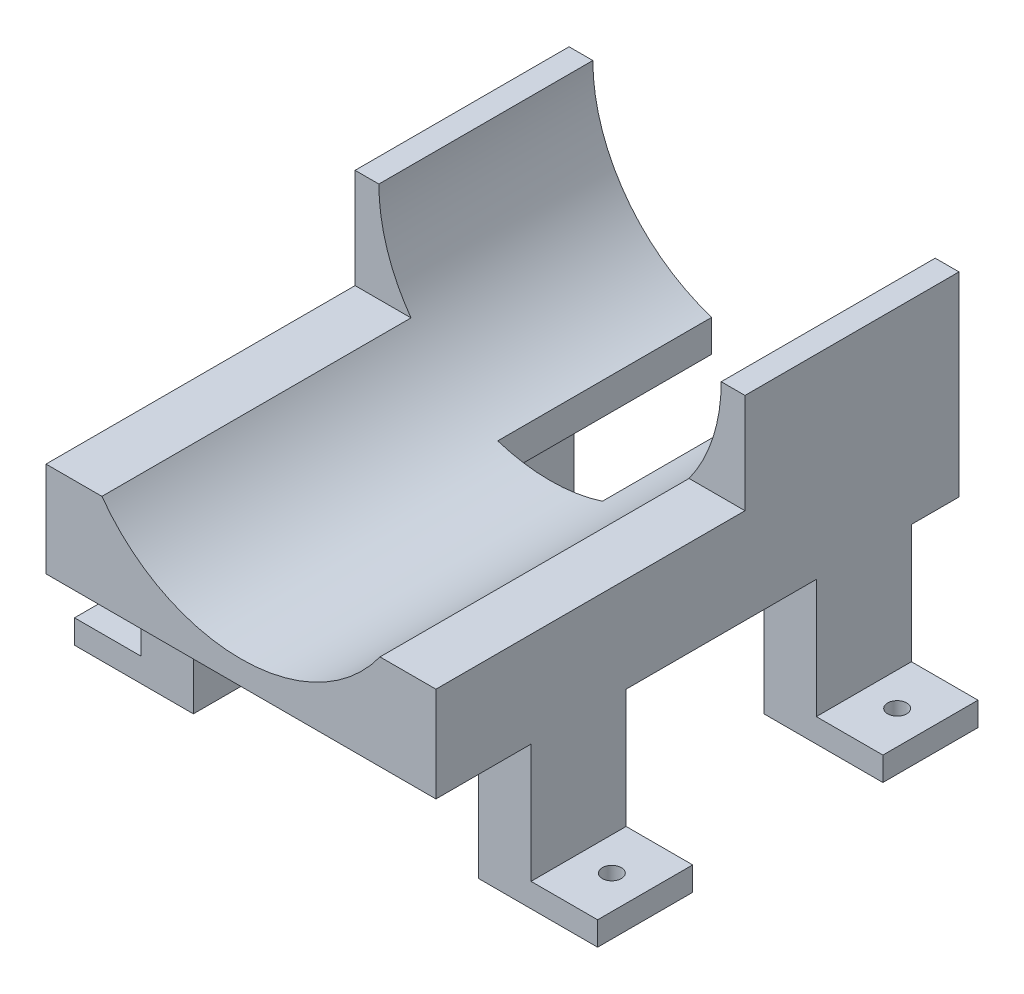
from build123d import *

# Parameters (mm, degrees)
SKETCH_1_R               = 36
EXTRUDE_1_DEPTH          = 90
SKETCH_2_W               = 22
SKETCH_2_H               = 6.721726998
CUT_EXTRUDE_1_DEPTH      = 45
CUT_EXTRUDE_2_DEPTH      = 108.060730429
CUT_EXTRUDE_2_DEPTH_BACK = 108.060730429
EXTRUDE_3_DEPTH          = 20
SKETCH_5_R               = 2
CUT_EXTRUDE_3_DEPTH      = 125.422666745
PATTERN_LINEAR_1_COUNT   = 2
PATTERN_LINEAR_1_PITCH   = 60
EXTRUDE_4_DEPTH          = 20


with BuildPart() as part:
    # 草圖1 → 填料-伸長1 (new body)
    with BuildSketch(Plane.XY):
        with BuildLine():
            Line((-41, 0), (-41, -41))
            Line((-41, -41), (41, -41))
            Line((41, -41), (41, 0))
            ThreePointArc((41, 0), (0, 41), (-41, 0))
        make_face()
        Circle(SKETCH_1_R, mode=Mode.SUBTRACT)
    extrude(amount=EXTRUDE_1_DEPTH)

    # 草圖2 → 除料-伸長1 (cut)
    with BuildSketch(Plane.XY):
        with Locations((0, -37.639136501)):
            Rectangle(SKETCH_2_W, SKETCH_2_H)
    extrude(amount=CUT_EXTRUDE_1_DEPTH, mode=Mode.SUBTRACT)

    # 草圖3 → 除料-伸長2 (cut, two sides: drawn at the far end of the back side and taken through both)
    with BuildSketch(Plane(origin=(0, 0, 0), x_dir=(0, 0, -1), z_dir=(1, 0, 0)).offset(-CUT_EXTRUDE_2_DEPTH_BACK)):
        Polygon((0, 41), (-90, 41), (-90, -21), (-45, -21), (-45, 0), (0, 0), align=None)
    extrude(amount=CUT_EXTRUDE_2_DEPTH + CUT_EXTRUDE_2_DEPTH_BACK, mode=Mode.SUBTRACT)

    # 草圖4 → 填料-伸長3 (add)
    with BuildSketch(Plane.XY.offset(90)):
        with BuildLine():
            Line((-30, -71), (-30, -27.946386022))
            ThreePointArc((-30, -27.946386022), (-32.791276328, -24.611637258), (-35.213640705, -21))
            Line((-35.213640705, -21), (-41, -21))
            Line((-41, -21), (-41, -66))
            Line((-41, -66), (-55, -66))
            Line((-55, -66), (-55, -71))
            Line((-55, -71), (-30, -71))
        make_face()
        with BuildLine():
            Line((30, -71), (30, -27.946386022))
            ThreePointArc((30, -27.946386022), (32.791276328, -24.611637258), (35.213640705, -21))
            Line((35.213640705, -21), (41, -21))
            Line((41, -21), (41, -66))
            Line((41, -66), (55, -66))
            Line((55, -66), (55, -71))
            Line((55, -71), (30, -71))
        make_face()
    extrude_3 = extrude(amount=-EXTRUDE_3_DEPTH)

    # 草圖5 → 除料-伸長3 (cut, through all)
    with BuildSketch(Plane(origin=(0, -66, 0), x_dir=(1, 0, 0), z_dir=(0, 1, 0))):
        with Locations((-48, -80)):
            Circle(SKETCH_5_R)
        with Locations((48, -80)):
            Circle(SKETCH_5_R)
    cut_extrude_3 = extrude(amount=-CUT_EXTRUDE_3_DEPTH, mode=Mode.SUBTRACT)

    # 直線複製排列1: 填料-伸長3, 除料-伸長3 ×2
    with Locations(*[(0, 0, -i * PATTERN_LINEAR_1_PITCH) for i in range(1, PATTERN_LINEAR_1_COUNT)]):
        add(extrude_3)
        add(cut_extrude_3, mode=Mode.SUBTRACT)

    # 草圖6 → 填料-伸長4 (add)
    with BuildSketch(Plane.XY.offset(90)):
        with BuildLine():
            Line((-29.240383034, -21), (-41.000001526, -21))
            Line((-41.000001526, -21), (-41, -41))
            Line((-41, -41), (41, -41))
            Line((41, -41), (41, -21))
            Line((41, -21), (29.240383034, -21))
            ThreePointArc((29.240383034, -21), (0, -36), (-29.240383034, -21))
        make_face()
    extrude(amount=EXTRUDE_4_DEPTH)


solid = part.part
